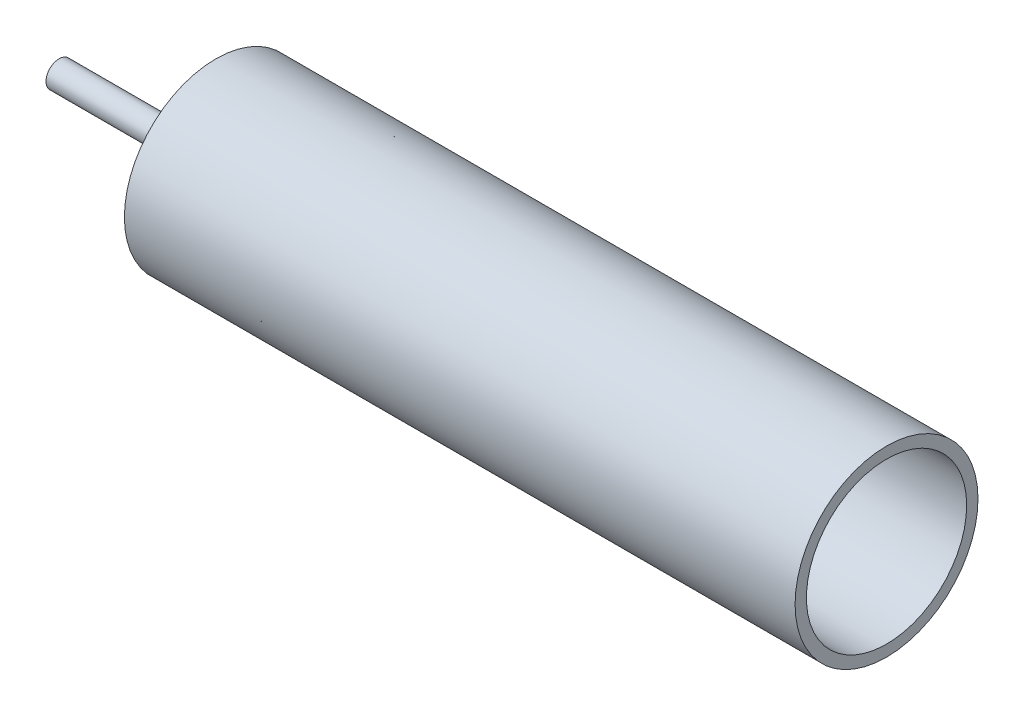
from build123d import *

# Parameters (mm, degrees)
SWEEP1_PROFILE_R   = 26.67
CUT_EXTRUDE1_START = -45.72
SKETCH2_R          = 26.67
SKETCH2_R_2        = 3.81
CUT_EXTRUDE1_DEPTH = 45.72
SHELL1_START       = -150.978
SHELL1_OUTLINE_R   = 23.368
SHELL1_DEPTH       = 192.278
SHELL1_START_2     = -197.46
SHELL1_2_OUTLINE_R = 1.27
SHELL1_2_DEPTH     = 46.482
SKETCH3_R          = 1.27
CUT_EXTRUDE2_DEPTH = 252.433520836


# Read off the part's stored shape, not the designer's step: Shell1
with BuildPart() as part:
    # Sweep1: sweep along a path in Sketch1
    with BuildLine(Plane(origin=(0, 0, 0), x_dir=(1, 0, 0), z_dir=(0, 1, 0))) as sweep1_path:
        Line((-200, 47.5), (41.3, 47.5))
    # Sweep1 profile (on start of the path) → Sweep1 (sweep)
    with BuildSketch(Plane(origin=(-200, 0, -47.5), x_dir=(0, 0, 1), z_dir=(1, 0, 0))):
        Circle(SWEEP1_PROFILE_R)
    sweep(path=sweep1_path.line)

    # Sketch2 → Cut-Extrude1 (cut)
    with BuildSketch(Plane.ZY.offset(200).offset(CUT_EXTRUDE1_START)):
        with Locations(Location((-47.5, 0, 0), (0, 0, 180))):
            Circle(SKETCH2_R)
        with Locations((-47.5, 0)):
            Circle(SKETCH2_R_2, mode=Mode.SUBTRACT)
    extrude(amount=CUT_EXTRUDE1_DEPTH, mode=Mode.SUBTRACT)

    # Shell1 outline → Shell1 (cut)
    with BuildSketch(Plane.YZ.offset(SHELL1_START)):
        with Locations((0, -47.5)):
            Circle(SHELL1_OUTLINE_R)
    extrude(amount=SHELL1_DEPTH, mode=Mode.SUBTRACT)

    # Shell1 2 outline → Shell1 2 (cut)
    with BuildSketch(Plane.YZ.offset(SHELL1_START_2)):
        with Locations((0, -47.5)):
            Circle(SHELL1_2_OUTLINE_R)
    extrude(amount=SHELL1_2_DEPTH, mode=Mode.SUBTRACT)

    # Sketch3 → Cut-Extrude2 (cut, through all)
    with BuildSketch(Plane(origin=(-197.46, 0, 0), x_dir=(0, 0, -1), z_dir=(1, 0, 0))):
        with Locations(Location((47.5, 0, 0), (0, 0, 180))):
            Circle(SKETCH3_R)
    extrude(amount=-CUT_EXTRUDE2_DEPTH, mode=Mode.SUBTRACT)


solid = part.part
